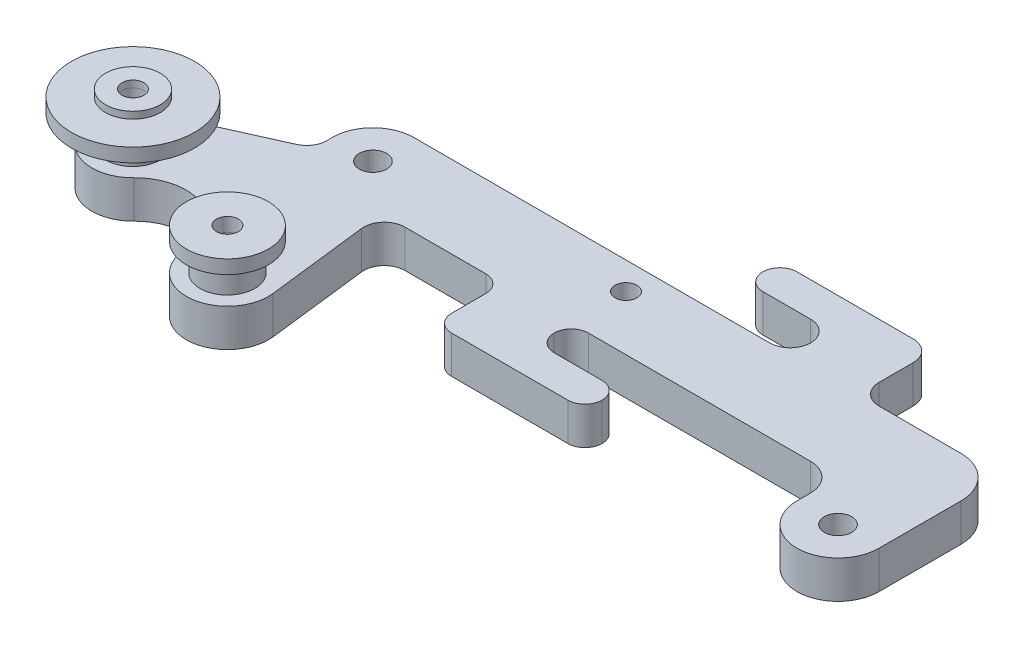
from build123d import *

# Parameters (mm, degrees)
SKETCH_1_R          = 2
EXTRUDE_1_DEPTH     = 5.5
EXTRUDE_START       = -5.5
SKETCH_3_R          = 2
EXTRUDE_3_DEPTH     = 5.5
FILLET_1_R          = 4
SKETCH_4_R          = 1.6
CUT_EXTRUDE_1_DEPTH = 10
EXTRUDE_5_DEPTH     = 5.5
FILLET_3_R          = 3
SKETCH_9_R          = 1.6
EXTRUDE_7_DEPTH     = 5.5
FILLET_5_R          = 3
SKETCH_10_R         = 2.9
SKETCH_10_R_2       = 1.6
EXTRUDE_8_DEPTH     = 4
SKETCH_10_R_3       = 4
SKETCH_10_R_4       = 3
EXTRUDE_8_2_DEPTH   = 4
EXTRUDE_8_3_DEPTH   = 4
EXTRUDE_8_4_DEPTH   = 4
SKETCH_11_R         = 9
SKETCH_11_R_2       = 3
SKETCH_11_R_3       = 6
SKETCH_11_R_4       = 2.9
SKETCH_11_R_5       = 1.6
EXTRUDE_9_DEPTH     = 2
EXTRUDE_10_DEPTH    = 5.5
FILLET_START        = -1
FILLET_6_DEPTH      = 7
FILLET_6_2_DEPTH    = 5.5
SKETCH_15_R         = 4
SKETCH_15_R_2       = 1.6
EXTRUDE_11_DEPTH    = 1


with BuildPart() as part:
    # ｽｹｯﾁ1 → ﾎﾞｽ - 押し出し1 (new body)
    with BuildSketch(Plane(origin=(0, 0, 0), x_dir=(1, 0, 0), z_dir=(0, 1, 0))):
        with BuildLine():
            Line((0, 6), (80, 6))
            ThreePointArc((80, 6), (86, 0), (80, -6))
            Line((80, -6), (0, -6))
            ThreePointArc((0, -6), (-6, 0), (0, 6))
        make_face()
        with Locations(Location((0, 0, 0), (0, 0, 270))):
            Circle(SKETCH_1_R, mode=Mode.SUBTRACT)
    extrude(amount=EXTRUDE_1_DEPTH)

    # ｽｹｯﾁ3 → ﾎﾞｽ - 押し出し3 (add)
    with BuildSketch(Plane(origin=(0, 5.5, 0), x_dir=(1, 0, 0), z_dir=(0, 1, 0)).offset(EXTRUDE_START)):
        with BuildLine():
            Line((86, 0), (86, -12))
            ThreePointArc((86, -12), (80, -18), (74, -12))
            Line((74, -12), (74, 0))
            ThreePointArc((74, 0), (80, 6), (86, 0))
        make_face()
        with Locations(Location((80, -12, 0), (0, 0, 270))):
            Circle(SKETCH_3_R, mode=Mode.SUBTRACT)
    extrude(amount=EXTRUDE_3_DEPTH)

    # ﾌｨﾚｯﾄ1
    fillet_1_edges = [part.edges().sort_by_distance(p)[0] for p in [
        (74, 2.75, 6),
    ]]
    fillet(fillet_1_edges, radius=FILLET_1_R)

    # ｽｹｯﾁ4 → ｶｯﾄ - 押し出し1 (cut)
    with BuildSketch(Plane(origin=(0, 5.5, 0), x_dir=(1, 0, 0), z_dir=(0, 1, 0))):
        with Locations(Location((35, 2, 0), (0, 0, 270))):
            Circle(SKETCH_4_R)
    extrude(amount=-CUT_EXTRUDE_1_DEPTH, mode=Mode.SUBTRACT)

    # ｽｹｯﾁ7 → ﾎﾞｽ - 押し出し5 (add)
    with BuildSketch(Plane(origin=(0, 5.5, 0), x_dir=(1, 0, 0), z_dir=(0, 1, 0))):
        with BuildLine():
            Line((55, 6), (55, 12))
            Line((55, 12), (45, 12))
            ThreePointArc((45, 12), (42.5, 14.5), (45, 17))
            Line((45, 17), (65, 17))
            Line((65, 17), (65, 6))
            Line((65, 6), (55, 6))
        make_face()
    extrude(amount=-EXTRUDE_5_DEPTH)

    # ﾌｨﾚｯﾄ3
    fillet_3_edges = [part.edges().sort_by_distance(p)[0] for p in [
        (65, 2.75, -6),
        (65, 2.75, -17),
        (55, 2.75, -12),
        (55, 2.75, -6),
    ]]
    fillet(fillet_3_edges, radius=FILLET_3_R - 0.0001)  # a hair under: the kernel refuses the full size

    # ｽｹｯﾁ9 → ﾎﾞｽ - 押し出し7 (add)
    with BuildSketch(Plane(origin=(0, 5.5, 0), x_dir=(1, 0, 0), z_dir=(0, 1, 0)).offset(EXTRUDE_START)):
        with BuildLine():
            Line((-22.151538165, -9.915107509), (-5.476429375, -2.451269325))
            ThreePointArc((-5.476429375, -2.451269325), (-3.262850291, -5.035256496), (0, -6))
            Line((0, -6), (7.285084265, -6))
            Line((7.285084265, -6), (9.43711483, -24.04622975))
            ThreePointArc((9.43711483, -24.04622975), (3.845204306, -30.745535844), (-2.520638926, -24.776766674))
            ThreePointArc((-2.520638926, -24.776766674), (-7.211047537, -17.847968959), (-15.398192461, -19.573897321))
            ThreePointArc((-15.398192461, -19.573897321), (-24.617526902, -18.829642925), (-22.151538165, -9.915107509))
        make_face()
        with Locations(Location((-19.70026884, -15.391536883, 0), (0, 0, 270))):
            Circle(SKETCH_9_R, mode=Mode.SUBTRACT)
        with Locations(Location((3.479327524, -24.756701719, 0), (0, 0, 270))):
            Circle(SKETCH_9_R, mode=Mode.SUBTRACT)
    extrude(amount=EXTRUDE_7_DEPTH)

    # ﾌｨﾚｯﾄ5
    fillet_5_edges = [part.edges().sort_by_distance(p)[0] for p in [
        (7.285084265, 2.75, 6),
        (-5.476429375, 2.75, 2.451269325),
    ]]
    fillet(fillet_5_edges, radius=FILLET_5_R)

    # ｽｹｯﾁ13 → ﾎﾞｽ - 押し出し10 (add)
    with BuildSketch(Plane(origin=(0, 5.5, 0), x_dir=(1, 0, 0), z_dir=(0, 1, 0))):
        Polygon((25, -6), (25, -16), (47, -16), (47, -11), (35, -11), (35, -6), align=None)
    extrude(amount=-EXTRUDE_10_DEPTH)

    # ﾌｨﾚｯﾄ6: read off the stored shape, not the designer's step
    # ﾌｨﾚｯﾄ6 outline → ﾌｨﾚｯﾄ6 (cut)
    with BuildSketch(Plane(origin=(0, 0, 0), x_dir=(1, 0, 0), z_dir=(0, 1, 0)).offset(FILLET_START)):
        with BuildLine():
            ThreePointArc((44.5, -11), (46.267766953, -11.732233047), (47, -13.5))
            Line((47, -13.5), (47, -11))
            Line((47, -11), (44.5, -11))
        make_face()
        with BuildLine():
            ThreePointArc((47, -13.5), (46.267766953, -15.267766953), (44.5, -16))
            Line((44.5, -16), (47, -16))
            Line((47, -16), (47, -13.5))
        make_face()
        with BuildLine():
            ThreePointArc((27.5, -16), (25.732233047, -15.267766953), (25, -13.5))
            Line((25, -13.5), (25, -16))
            Line((25, -16), (27.5, -16))
        make_face()
    extrude(amount=FILLET_6_DEPTH, mode=Mode.SUBTRACT)

    # Fillet 6 2 outline → Fillet 6 2 (add)
    with BuildSketch(Plane(origin=(0, 0, 0), x_dir=(1, 0, 0), z_dir=(0, 1, 0))):
        with BuildLine():
            ThreePointArc((22.5, -6), (24.267766953, -6.732233047), (25, -8.5))
            Line((25, -8.5), (25, -6))
            Line((25, -6), (22.5, -6))
        make_face()
        with BuildLine():
            Line((35, -6), (35, -8.5))
            ThreePointArc((35, -8.5), (35.732233047, -6.732233047), (37.5, -6))
            Line((37.5, -6), (35, -6))
        make_face()
        with BuildLine():
            Line((35, -11), (37.5, -11))
            ThreePointArc((37.5, -11), (35.732233047, -10.267766953), (35, -8.5))
            Line((35, -8.5), (35, -11))
        make_face()
    extrude(amount=FILLET_6_2_DEPTH)


with BuildPart() as body_2:
    # ｽｹｯﾁ10 → ﾎﾞｽ - 押し出し8 (new body)
    with BuildSketch(Plane(origin=(0, 5.5, 0), x_dir=(1, 0, 0), z_dir=(0, 1, 0))):
        with Locations(Location((3.479327524, -24.756701719, 0), (0, 0, 270))):
            Circle(SKETCH_10_R)
        with Locations(Location((3.479327524, -24.756701719, 0), (0, 0, 270))):
            Circle(SKETCH_10_R_2, mode=Mode.SUBTRACT)
    extrude(amount=EXTRUDE_8_DEPTH)


with BuildPart() as body_3:
    # ｽｹｯﾁ10 → Extrude 8 2 (new body)
    with BuildSketch(Plane(origin=(0, 5.5, 0), x_dir=(1, 0, 0), z_dir=(0, 1, 0))):
        with Locations(Location((3.479327524, -24.756701719, 0), (0, 0, 270))):
            Circle(SKETCH_10_R_3)
        with Locations(Location((3.479327524, -24.756701719, 0), (0, 0, 270))):
            Circle(SKETCH_10_R_4, mode=Mode.SUBTRACT)
    extrude(amount=EXTRUDE_8_2_DEPTH)


with BuildPart() as body_4:
    # ｽｹｯﾁ10 → Extrude 8 3 (new body)
    with BuildSketch(Plane(origin=(0, 5.5, 0), x_dir=(1, 0, 0), z_dir=(0, 1, 0))):
        with Locations(Location((-19.70026884, -15.391536883, 0), (0, 0, 270))):
            Circle(SKETCH_10_R)
        with Locations(Location((-19.70026884, -15.391536883, 0), (0, 0, 270))):
            Circle(SKETCH_10_R_2, mode=Mode.SUBTRACT)
    extrude(amount=EXTRUDE_8_3_DEPTH)


with BuildPart() as body_5:
    # ｽｹｯﾁ10 → Extrude 8 4 (new body)
    with BuildSketch(Plane(origin=(0, 5.5, 0), x_dir=(1, 0, 0), z_dir=(0, 1, 0))):
        with Locations(Location((-19.70026884, -15.391536883, 0), (0, 0, 270))):
            Circle(SKETCH_10_R_3)
        with Locations(Location((-19.70026884, -15.391536883, 0), (0, 0, 270))):
            Circle(SKETCH_10_R_4, mode=Mode.SUBTRACT)
    extrude(amount=EXTRUDE_8_4_DEPTH)


with BuildPart() as body_6:
    # ｽｹｯﾁ11 → ﾎﾞｽ - 押し出し9 (new body)
    # profile 1 of 4: a face of its own
    with BuildSketch(Plane(origin=(0, 9.5, 0), x_dir=(1, 0, 0), z_dir=(0, 1, 0))):
        with Locations(Location((-19.70026884, -15.391536883, 0), (0, 0, 270))):
            Circle(SKETCH_11_R)
        with Locations(Location((-19.70026884, -15.391536883, 0), (0, 0, 270))):
            Circle(SKETCH_11_R_2, mode=Mode.SUBTRACT)
    # profile 2 of 4: a face of its own
    with BuildSketch(Plane(origin=(0, 9.5, 0), x_dir=(1, 0, 0), z_dir=(0, 1, 0))):
        with Locations(Location((3.479327524, -24.756701719, 0), (0, 0, 270))):
            Circle(SKETCH_11_R_3)
        with Locations(Location((3.479327524, -24.756701719, 0), (0, 0, 270))):
            Circle(SKETCH_11_R_4, mode=Mode.SUBTRACT)
    # profile 3 of 4: a face of its own
    with BuildSketch(Plane(origin=(0, 9.5, 0), x_dir=(1, 0, 0), z_dir=(0, 1, 0))):
        with Locations(Location((3.479327524, -24.756701719, 0), (0, 0, 270))):
            Circle(SKETCH_11_R_4)
        with Locations(Location((3.479327524, -24.756701719, 0), (0, 0, 270))):
            Circle(SKETCH_11_R_5, mode=Mode.SUBTRACT)
    # profile 4 of 4: a face of its own
    with BuildSketch(Plane(origin=(0, 9.5, 0), x_dir=(1, 0, 0), z_dir=(0, 1, 0))):
        with Locations(Location((-19.70026884, -15.391536883, 0), (0, 0, 270))):
            Circle(SKETCH_11_R_4)
        with Locations(Location((-19.70026884, -15.391536883, 0), (0, 0, 270))):
            Circle(SKETCH_11_R_5, mode=Mode.SUBTRACT)
    extrude(amount=EXTRUDE_9_DEPTH)


with BuildPart() as body_7:
    # ｽｹｯﾁ15 → ﾎﾞｽ - 押し出し11 (new body)
    with BuildSketch(Plane(origin=(0, 11.5, 0), x_dir=(1, 0, 0), z_dir=(0, 1, 0))):
        with Locations(Location((-19.70026884, -15.391536883, 0), (0, 0, 180))):
            Circle(SKETCH_15_R)
        with Locations(Location((-19.70026884, -15.391536883, 0), (0, 0, 180))):
            Circle(SKETCH_15_R_2, mode=Mode.SUBTRACT)
    extrude(amount=EXTRUDE_11_DEPTH)


solid = Compound([part.part, body_2.part, body_3.part, body_4.part, body_5.part, body_6.part, body_7.part])
